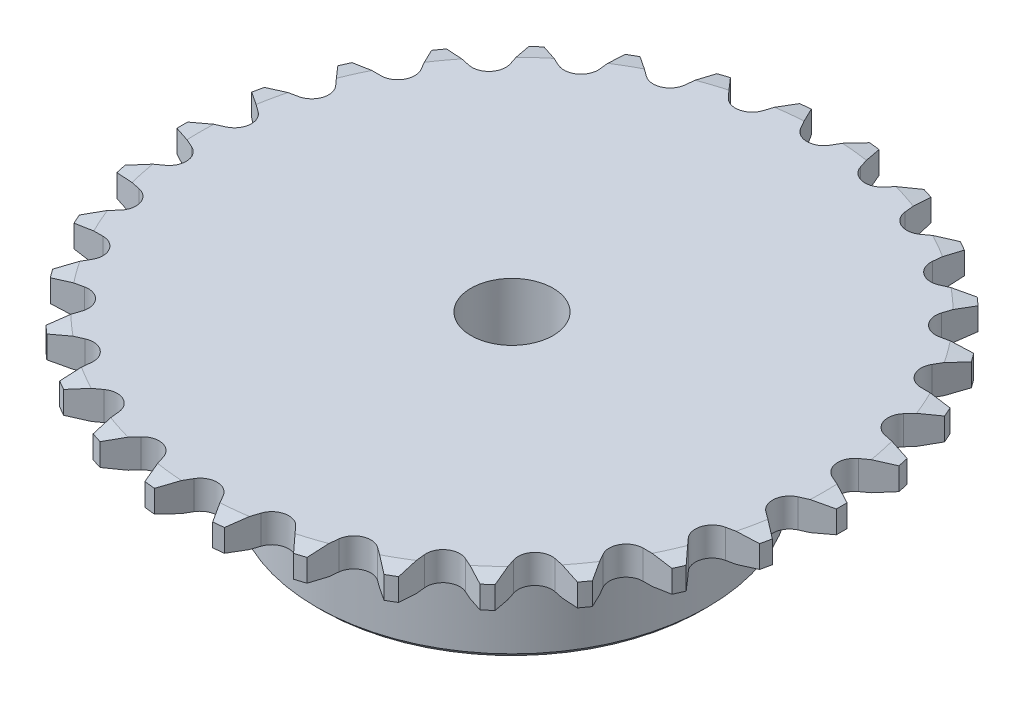
from build123d import *

# Parameters (mm, degrees)
CUT_EXTRUDE1_REACH = 50.109
CIRPATTERN1_START  = -2.794
CIRPATTERN1_DEPTH  = 2.794
SKETCH3_R          = 4
CUT_EXTRUDE2_DEPTH = 49.025751431
SKETCH5_R          = 2.25
CUT_EXTRUDE3_DEPTH = 20
SKETCH6_R          = 2.25
CUT_EXTRUDE4_DEPTH = 20


# Read off the part's stored shape, not the designer's step: CirPattern1
with BuildPart() as part:
    # Sketch1 → Revolve2 (revolve)
    with BuildSketch(Plane.XY, mode=Mode.PRIVATE) as revolve2_sk:
        Polygon((0, 0), (30.374501841, 0), (32.113107142, -0.306563023), (32.113107142, -2.487436977), (30.374501841, -2.794), (19.05, -2.794), (19.05, -15.375), (18.55, -15.875), (0, -15.875), align=None)
    revolve(revolve2_sk.sketch.rotate(Axis((0, 0, 0), (0, -1, 0)), 180), axis=Axis((0, 0, 0), (0, -1, 0)))

    # Cut-Extrude1: up to this face of the body (flat: up to its plane)
    cut_extrude1_end = Plane(part.part.faces().sort_by_distance((29.515381192, -2.794, 0))[0])
    # Sketch2 → Cut-Extrude1 (cut, up to the picked face)
    with BuildSketch(Plane(origin=(0, 0, 0), x_dir=(1, 0, 0), z_dir=(0, 1, 0)), mode=Mode.PRIVATE) as cut_extrude1_sk1:
        with BuildLine():
            Line((1.428941916, 29.549501841), (2.836569262, 31.987583922))
            ThreePointArc((2.836569262, 31.987583922), (0, 32.113107142), (-2.836569262, 31.987583922))
            Line((-2.836569262, 31.987583922), (-1.428941916, 29.549501841))
            ThreePointArc((-1.428941916, 29.549501841), (0, 28.724501841), (1.428941916, 29.549501841))
        make_face()
    cut_extrude1_tool1 = split(extrude(cut_extrude1_sk1.sketch, amount=-CUT_EXTRUDE1_REACH, mode=Mode.PRIVATE), bisect_by=cut_extrude1_end, keep=Keep.BOTH, mode=Mode.PRIVATE)
    add(cut_extrude1_tool1.solids().sort_by(Axis((0, 0, -30.720189), (0, -1, 0)))[0], mode=Mode.SUBTRACT)

    # CirPattern1 outline → CirPattern1 (cut)
    with BuildSketch(Plane(origin=(0, 0, 0), x_dir=(1, 0, 0), z_dir=(0, 1, 0)).offset(CIRPATTERN1_START)):
        with BuildLine():
            ThreePointArc((-29.120344913, -13.537250921), (-27.810766579, -16.056553571), (-26.283775651, -18.450333001))
            Line((-26.283775651, -18.450333001), (-24.876148306, -16.012250921))
            ThreePointArc((-24.876148306, -16.012250921), (-24.876148306, -14.362250921), (-26.305090222, -13.537250921))
            Line((-26.305090222, -13.537250921), (-29.120344913, -13.537250921))
        make_face()
        with BuildLine():
            ThreePointArc((-3.876009241, 31.878334378), (-6.676690404, 31.411358704), (-9.425176076, 30.698822555))
            Line((-9.425176076, 30.698822555), (-7.541402998, 28.606680599))
            ThreePointArc((-7.541402998, 28.606680599), (-5.972159746, 28.096802558), (-4.745970784, 29.200868059))
            Line((-4.745970784, 29.200868059), (-3.876009241, 31.878334378))
        make_face()
        with BuildLine():
            ThreePointArc((-10.41918754, 30.375848652), (-13.061577398, 29.336783161), (-15.601857469, 28.068375333))
            Line((-15.601857469, 28.068375333), (-13.32426858, 26.413610145))
            ThreePointArc((-13.32426858, 26.413610145), (-11.683307453, 26.24113818), (-10.713461787, 27.576016221))
            Line((-10.713461787, 27.576016221), (-10.41918754, 30.375848652))
        make_face()
        with BuildLine():
            ThreePointArc((-16.506997347, 27.545792581), (-18.875610783, 25.980049421), (-21.096662824, 24.211205423))
            Line((-21.096662824, 24.211205423), (-18.524799689, 23.06613818))
            ThreePointArc((-18.524799689, 23.06613818), (-16.883838562, 23.238610145), (-16.212723101, 24.74596015))
            Line((-16.212723101, 24.74596015), (-16.506997347, 27.545792581))
        make_face()
        with BuildLine():
            ThreePointArc((-21.873372161, 23.511853194), (-23.864689403, 21.487862854), (-25.669442781, 19.295889657))
            Line((-25.669442781, 19.295889657), (-22.91570816, 18.710565294))
            ThreePointArc((-22.91570816, 18.710565294), (-21.346464908, 19.220443334), (-21.003410618, 20.834386876))
            Line((-21.003410618, 20.834386876), (-21.873372161, 23.511853194))
        make_face()
        with BuildLine():
            ThreePointArc((-26.283775651, 18.450333001), (-27.81076658, 16.056553571), (-29.120344913, 13.537250921))
            Line((-29.120344913, 13.537250921), (-26.305090222, 13.537250921))
            ThreePointArc((-26.305090222, 13.537250921), (-24.876148306, 14.362250921), (-24.876148306, 16.012250921))
            Line((-24.876148306, 16.012250921), (-26.283775651, 18.450333001))
        make_face()
        with BuildLine():
            ThreePointArc((-29.545452022, 12.582444721), (-30.541379806, 9.923495849), (-31.298548237, 7.186969361))
            Line((-31.298548237, 7.186969361), (-28.544813616, 7.772293723))
            ThreePointArc((-28.544813616, 7.772293723), (-27.318624654, 8.876359224), (-27.661678943, 10.490302765))
            Line((-27.661678943, 10.490302765), (-29.545452022, 12.582444721))
        make_face()
        with BuildLine():
            ThreePointArc((-31.515850364, 6.164643229), (-31.937188181, 3.35673374), (-32.108854816, 0.522582753))
            Line((-32.108854816, 0.522582753), (-29.536991681, 1.667649995))
            ThreePointArc((-29.536991681, 1.667649995), (-28.567146015, 3.002528036), (-29.238261476, 4.509878041))
            Line((-29.238261476, 4.509878041), (-31.515850364, 6.164643229))
        make_face()
        with BuildLine():
            ThreePointArc((-32.108854816, -0.522582753), (-31.937188181, -3.35673374), (-31.515850364, -6.164643229))
            Line((-31.515850364, -6.164643229), (-29.238261476, -4.509878041))
            ThreePointArc((-29.238261476, -4.509878041), (-28.567146015, -3.002528036), (-29.536991681, -1.667649995))
            Line((-29.536991681, -1.667649995), (-32.108854816, -0.522582753))
        make_face()
        with BuildLine():
            ThreePointArc((-31.298548237, -7.186969361), (-30.541379806, -9.923495849), (-29.545452022, -12.582444721))
            Line((-29.545452022, -12.582444721), (-27.661678943, -10.490302765))
            ThreePointArc((-27.661678943, -10.490302765), (-27.318624654, -8.876359224), (-28.544813616, -7.772293723))
            Line((-28.544813616, -7.772293723), (-31.298548237, -7.186969361))
        make_face()
        with BuildLine():
            Line((7.541402998, 28.606680599), (9.425176076, 30.698822555))
            ThreePointArc((9.425176076, 30.698822555), (6.676690404, 31.411358704), (3.876009241, 31.878334378))
            Line((3.876009241, 31.878334378), (4.745970784, 29.200868059))
            ThreePointArc((4.745970784, 29.200868059), (5.972159746, 28.096802558), (7.541402998, 28.606680599))
        make_face()
        with BuildLine():
            Line((13.32426858, 26.413610145), (15.601857469, 28.068375333))
            ThreePointArc((15.601857469, 28.068375333), (13.061577398, 29.336783161), (10.41918754, 30.375848652))
            Line((10.41918754, 30.375848652), (10.713461787, 27.576016221))
            ThreePointArc((10.713461787, 27.576016221), (11.683307453, 26.24113818), (13.32426858, 26.413610145))
        make_face()
        with BuildLine():
            Line((18.524799689, 23.06613818), (21.096662824, 24.211205423))
            ThreePointArc((21.096662824, 24.211205423), (18.875610783, 25.980049421), (16.506997347, 27.545792581))
            Line((16.506997347, 27.545792581), (16.212723101, 24.74596015))
            ThreePointArc((16.212723101, 24.74596015), (16.883838562, 23.238610145), (18.524799689, 23.06613818))
        make_face()
        with BuildLine():
            Line((22.91570816, 18.710565294), (25.669442781, 19.295889657))
            ThreePointArc((25.669442781, 19.295889657), (23.864689403, 21.487862854), (21.873372161, 23.511853194))
            Line((21.873372161, 23.511853194), (21.003410618, 20.834386876))
            ThreePointArc((21.003410618, 20.834386876), (21.346464908, 19.220443334), (22.91570816, 18.710565294))
        make_face()
        with BuildLine():
            Line((26.305090222, 13.537250921), (29.120344913, 13.537250921))
            ThreePointArc((29.120344913, 13.537250921), (27.81076658, 16.056553571), (26.283775651, 18.450333001))
            Line((26.283775651, 18.450333001), (24.876148306, 16.012250921))
            ThreePointArc((24.876148306, 16.012250921), (24.876148306, 14.362250921), (26.305090222, 13.537250921))
        make_face()
        with BuildLine():
            Line((28.544813616, 7.772293723), (31.298548237, 7.186969361))
            ThreePointArc((31.298548237, 7.186969361), (30.541379806, 9.923495849), (29.545452022, 12.582444721))
            Line((29.545452022, 12.582444721), (27.661678943, 10.490302765))
            ThreePointArc((27.661678943, 10.490302765), (27.318624654, 8.876359224), (28.544813616, 7.772293723))
        make_face()
        with BuildLine():
            Line((29.536991681, 1.667649995), (32.108854816, 0.522582753))
            ThreePointArc((32.108854816, 0.522582753), (31.937188181, 3.35673374), (31.515850364, 6.164643229))
            Line((31.515850364, 6.164643229), (29.238261476, 4.509878041))
            ThreePointArc((29.238261476, 4.509878041), (28.567146015, 3.002528036), (29.536991681, 1.667649995))
        make_face()
        with BuildLine():
            Line((29.238261476, -4.509878041), (31.515850364, -6.164643229))
            ThreePointArc((31.515850364, -6.164643229), (31.937188181, -3.35673374), (32.108854816, -0.522582753))
            Line((32.108854816, -0.522582753), (29.536991681, -1.667649995))
            ThreePointArc((29.536991681, -1.667649995), (28.567146015, -3.002528036), (29.238261476, -4.509878041))
        make_face()
        with BuildLine():
            Line((27.661678943, -10.490302765), (29.545452022, -12.582444721))
            ThreePointArc((29.545452022, -12.582444721), (30.541379806, -9.923495849), (31.298548237, -7.186969361))
            Line((31.298548237, -7.186969361), (28.544813616, -7.772293723))
            ThreePointArc((28.544813616, -7.772293723), (27.318624654, -8.876359224), (27.661678943, -10.490302765))
        make_face()
        with BuildLine():
            Line((24.876148306, -16.012250921), (26.283775651, -18.450333001))
            ThreePointArc((26.283775651, -18.450333001), (27.810766579, -16.056553571), (29.120344913, -13.537250921))
            Line((29.120344913, -13.537250921), (26.305090222, -13.537250921))
            ThreePointArc((26.305090222, -13.537250921), (24.876148306, -14.362250921), (24.876148306, -16.012250921))
        make_face()
        with BuildLine():
            Line((21.003410618, -20.834386876), (21.873372161, -23.511853194))
            ThreePointArc((21.873372161, -23.511853194), (23.864689403, -21.487862854), (25.669442781, -19.295889657))
            Line((25.669442781, -19.295889657), (22.91570816, -18.710565294))
            ThreePointArc((22.91570816, -18.710565294), (21.346464908, -19.220443334), (21.003410618, -20.834386876))
        make_face()
        with BuildLine():
            Line((16.212723101, -24.74596015), (16.506997347, -27.545792581))
            ThreePointArc((16.506997347, -27.545792581), (18.875610783, -25.98004942), (21.096662824, -24.211205423))
            Line((21.096662824, -24.211205423), (18.524799689, -23.06613818))
            ThreePointArc((18.524799689, -23.06613818), (16.883838562, -23.238610145), (16.212723101, -24.74596015))
        make_face()
        with BuildLine():
            Line((10.713461787, -27.576016221), (10.41918754, -30.375848652))
            ThreePointArc((10.41918754, -30.375848652), (13.061577398, -29.33678316), (15.601857469, -28.068375333))
            Line((15.601857469, -28.068375333), (13.32426858, -26.413610145))
            ThreePointArc((13.32426858, -26.413610145), (11.683307453, -26.24113818), (10.713461787, -27.576016221))
        make_face()
        with BuildLine():
            Line((4.745970784, -29.200868059), (3.876009241, -31.878334377))
            ThreePointArc((3.876009241, -31.878334377), (6.676690403, -31.411358703), (9.425176076, -30.698822555))
            Line((9.425176076, -30.698822555), (7.541402998, -28.606680599))
            ThreePointArc((7.541402998, -28.606680599), (5.972159746, -28.096802558), (4.745970784, -29.200868059))
        make_face()
        with BuildLine():
            Line((-1.428941916, -29.549501841), (-2.836569262, -31.987583922))
            ThreePointArc((-2.836569262, -31.987583922), (0, -32.113107142), (2.836569262, -31.987583922))
            Line((2.836569262, -31.987583922), (1.428941916, -29.549501841))
            ThreePointArc((1.428941916, -29.549501841), (0, -28.724501841), (-1.428941916, -29.549501841))
        make_face()
        with BuildLine():
            Line((-7.541402998, -28.606680599), (-9.425176076, -30.698822555))
            ThreePointArc((-9.425176076, -30.698822555), (-6.676690403, -31.411358703), (-3.876009241, -31.878334377))
            Line((-3.876009241, -31.878334377), (-4.745970784, -29.200868059))
            ThreePointArc((-4.745970784, -29.200868059), (-5.972159746, -28.096802558), (-7.541402998, -28.606680599))
        make_face()
        with BuildLine():
            Line((-13.32426858, -26.413610145), (-15.601857469, -28.068375333))
            ThreePointArc((-15.601857469, -28.068375333), (-13.061577398, -29.33678316), (-10.41918754, -30.375848652))
            Line((-10.41918754, -30.375848652), (-10.713461787, -27.576016221))
            ThreePointArc((-10.713461787, -27.576016221), (-11.683307453, -26.24113818), (-13.32426858, -26.413610145))
        make_face()
        with BuildLine():
            Line((-18.524799689, -23.06613818), (-21.096662824, -24.211205423))
            ThreePointArc((-21.096662824, -24.211205423), (-18.875610783, -25.98004942), (-16.506997347, -27.545792581))
            Line((-16.506997347, -27.545792581), (-16.212723101, -24.74596015))
            ThreePointArc((-16.212723101, -24.74596015), (-16.883838562, -23.238610145), (-18.524799689, -23.06613818))
        make_face()
        with BuildLine():
            Line((-22.91570816, -18.710565294), (-25.669442781, -19.295889657))
            ThreePointArc((-25.669442781, -19.295889657), (-23.864689403, -21.487862854), (-21.873372161, -23.511853194))
            Line((-21.873372161, -23.511853194), (-21.003410618, -20.834386876))
            ThreePointArc((-21.003410618, -20.834386876), (-21.346464908, -19.220443334), (-22.91570816, -18.710565294))
        make_face()
    extrude(amount=CIRPATTERN1_DEPTH, mode=Mode.SUBTRACT)

    # Sketch3 → Cut-Extrude2 (cut, through all)
    with BuildSketch(Plane.XZ.offset(15.875)):
        Circle(SKETCH3_R)
    extrude(amount=-CUT_EXTRUDE2_DEPTH, mode=Mode.SUBTRACT)

    # Sketch5 → Cut-Extrude3 (cut)
    with BuildSketch(Plane(origin=(0, 0, 0), x_dir=(0, 0, -1), z_dir=(1, 0, 0))):
        with Locations((0, -11.375)):
            Circle(SKETCH5_R)
    extrude(amount=-CUT_EXTRUDE3_DEPTH, mode=Mode.SUBTRACT)

    # Sketch6 → Cut-Extrude4 (cut)
    with BuildSketch(Plane.XY):
        with Locations((0, -11.375)):
            Circle(SKETCH6_R)
    extrude(amount=-CUT_EXTRUDE4_DEPTH, mode=Mode.SUBTRACT)


solid = part.part
